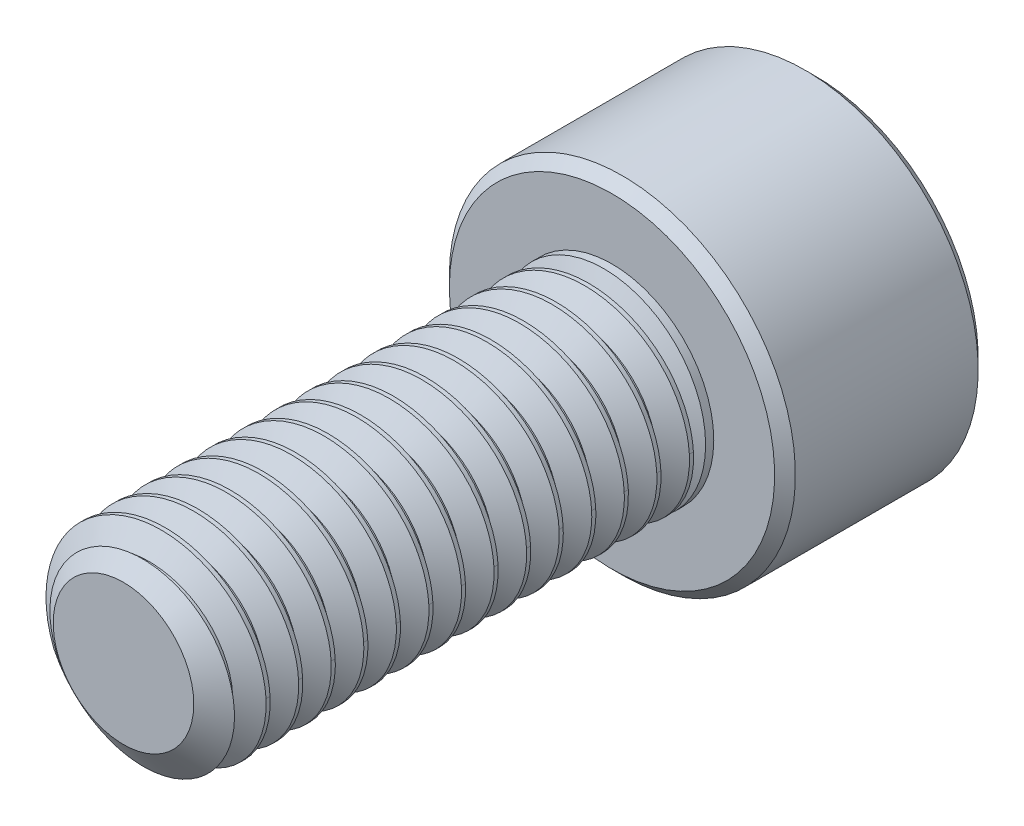
from build123d import *

# Parameters (mm, degrees)
SKETCH1_R          = 2.5
EXTRUDE1_DEPTH     = 12
CUT_SWEEP1_PITCH   = 0.8
SKETCH6_R          = 4.25
EXTRUDE2_DEPTH     = 5
CUT_EXTRUDE1_DEPTH = 3
CHAMFER1_SIZE      = 0.255


with BuildPart() as part:
    # Sketch1 → Extrude1 (new body)
    with BuildSketch(Plane.XY):
        Circle(SKETCH1_R)
    extrude(amount=-EXTRUDE1_DEPTH)

    # Cut-Sweep1: the profile of Sketch3 profile screwed along a right-hand helix of 16 turns, 6 arcs to a turn; built about Z, then put on its axis
    cut_sweep1_z = Axis((0, 0, 0), (0, 0, 1))
    cut_sweep1_corners = [(2.5003, 0, -0.700173205), (1.980384758, 0, -0.4), (1.980384758, 0, -0.3), (2.5003, 0, 0.000173205)]
    with BuildLine(mode=Mode.PRIVATE) as cut_sweep1_profile:
        Line(cut_sweep1_corners[0], cut_sweep1_corners[1])
        Line(cut_sweep1_corners[1], cut_sweep1_corners[2])
        Line(cut_sweep1_corners[2], cut_sweep1_corners[3])
        Line(cut_sweep1_corners[3], cut_sweep1_corners[0])
    cut_sweep1_cap = Face(cut_sweep1_profile.wire())
    cut_sweep1_turn_angles = [0, 30, 60, 90, 120, 150, 180, 210, 240, 270, 300, 330, 360]
    cut_sweep1_turn_weights = [1, 0.8660254037844387, 1, 0.8660254037844387, 1, 0.8660254037844387, 1, 0.8660254037844387, 1, 0.8660254037844387, 1, 0.8660254037844387, 1]
    cut_sweep1_turn_rails = [Edge.make_bspline([Vector(p[0], p[1], 0).rotate(cut_sweep1_z, cut_sweep1_turn_angles[k]) / cut_sweep1_turn_weights[k] + Vector(0, 0, p[2] + CUT_SWEEP1_PITCH * cut_sweep1_turn_angles[k] / 360) for k in range(13)], [0, 0, 0, 1, 1, 2, 2, 3, 3, 4, 4, 5, 5, 6, 6, 6], 2, cut_sweep1_turn_weights) for p in cut_sweep1_corners]
    cut_sweep1_turn_sides = [Face.make_surface_from_curves(cut_sweep1_turn_rails[p[0]], cut_sweep1_turn_rails[p[1]]) for p in [(0, 1), (1, 2), (2, 3), (3, 0)]]
    cut_sweep1 = Plane(origin=(0, 0, 0), x_dir=(0, 1, 0), z_dir=(0, 0, -1)) * Solid(Shell([*[p.moved(Location((0, 0, CUT_SWEEP1_PITCH * i))) for i in range(16) for p in cut_sweep1_turn_sides], cut_sweep1_cap, cut_sweep1_cap.rotate(cut_sweep1_z, 5760).moved(Location((0, 0, CUT_SWEEP1_PITCH * 5760 / 360)))]))
    add(cut_sweep1, mode=Mode.SUBTRACT)

    # Sketch4 → Cut-Revolve1 (revolve, cut)
    with BuildSketch(Plane(origin=(0, 0, 0), x_dir=(0, 0, -1), z_dir=(1, 0, 0)), mode=Mode.PRIVATE) as cut_revolve1_sk:
        Polygon((0.541691224, 2.5), (0, 1.726384758), (0, 2.5), align=None)
    revolve(cut_revolve1_sk.sketch.rotate(Axis((0, 0, 0), (0, 0, -1)), 260.43858876), axis=Axis((0, 0, 0), (0, 0, -1)), mode=Mode.SUBTRACT)

    # Sketch6 → Extrude2 (add)
    with BuildSketch(Plane(origin=(0, 0, -12), x_dir=(-1, 0, 0), z_dir=(0, 0, -1))):
        Circle(SKETCH6_R)
    extrude(amount=EXTRUDE2_DEPTH)

    # Sketch7 → Cut-Extrude1 (cut)
    with BuildSketch(Plane(origin=(0, 0, -17), x_dir=(-1, 0, 0), z_dir=(0, 0, -1))):
        Polygon((0, 2.309401077), (-2, 1.154700538), (-2, -1.154700538), (0, -2.309401077), (2, -1.154700538), (2, 1.154700538), align=None)
    extrude(amount=-CUT_EXTRUDE1_DEPTH, mode=Mode.SUBTRACT)

    # Cut-Extrude2 cone 1 section (through the dimple's axis) → Cut-Extrude2 (revolve, cut)
    with BuildSketch(Plane(origin=(0, 0, -17), x_dir=(0, 1, 0), z_dir=(1, 0, 0))):
        Polygon((0, 0), (2.309401077, 0), (0, 2.309401077), align=None)
    revolve(axis=Axis((0, 0, -17), (0, 0, 1)), mode=Mode.SUBTRACT)

    # Chamfer1
    chamfer1_edges = [part.edges().sort_by_distance(p)[0] for p in [
        (4.25, 0, -12),
        (4.25, 0, -17),
    ]]
    chamfer(chamfer1_edges, length=CHAMFER1_SIZE)

    # Sketch10 → Revolve1 (revolve)
    with BuildSketch(Plane(origin=(0, 0, 0), x_dir=(0, 0, -1), z_dir=(1, 0, 0)), mode=Mode.PRIVATE) as revolve1_sk:
        Polygon((12, 2.5), (12, 0), (10.764466094, 0), (11.8, 2.5), align=None)
    revolve(revolve1_sk.sketch.rotate(Axis((0, 0, -12), (0, 0, 1)), 270), axis=Axis((0, 0, -12), (0, 0, 1)))


solid = part.part
